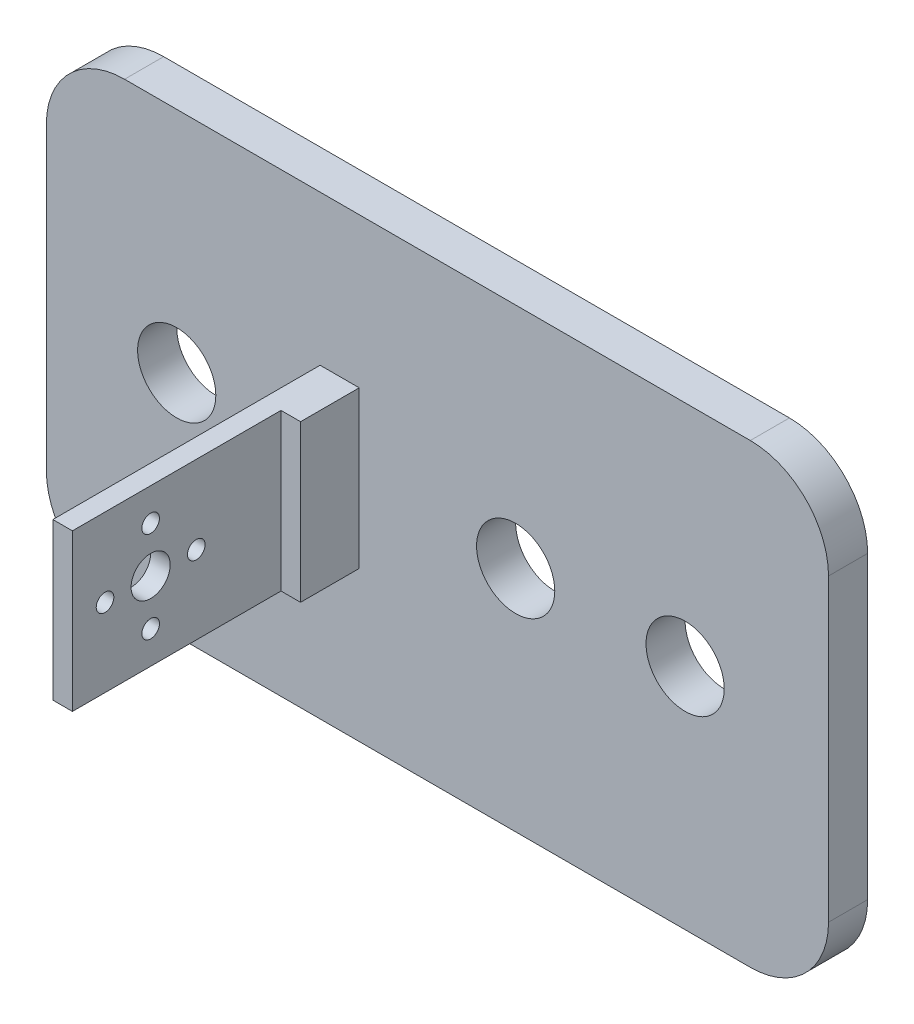
from build123d import *

# Parameters (mm, degrees)
S_BOX1_W      = 120
S_BOX1_H      = 70
BOSS_1_DEPTH  = 6
S_BOX2_W      = 3
S_BOX2_H      = 24
BOSS_2_DEPTH  = 41.5
S_BOX3_W      = 3.5
S_BOX3_H      = 24
BOSS_3_DEPTH  = 9.5
S_HOLE4_R     = 3
HOLE_4_DEPTH  = 3.2
S_HOLE5_R     = 1.35
HOLE_5_DEPTH  = 3.2
S_HOLE6_R     = 1.35
HOLE_6_DEPTH  = 3.2
S_HOLE7_R     = 1.35
HOLE_7_DEPTH  = 3.2
S_HOLE8_R     = 1.35
HOLE_8_DEPTH  = 3.2
S_HOLE9_R     = 6
HOLE_9_DEPTH  = 6.2
S_HOLE10_R    = 6
HOLE_10_DEPTH = 6.2
S_HOLE11_R    = 6
HOLE_11_DEPTH = 6.2
CUT_12_DEPTH  = 6.2
CUT_13_DEPTH  = 6.2
CUT_14_DEPTH  = 6.2
CUT_15_DEPTH  = 6.2


with BuildPart() as part:
    # S_box1 → Boss_1 (new body)
    with BuildSketch(Plane.XY.offset(-35)):
        with Locations((-2, 0)):
            Rectangle(S_BOX1_W, S_BOX1_H)
    extrude(amount=BOSS_1_DEPTH)

    # S_box2 → Boss_2 (add)
    with BuildSketch(Plane.XY.offset(-29.5)):
        with Locations((-18.5, 0)):
            Rectangle(S_BOX2_W, S_BOX2_H)
    extrude(amount=BOSS_2_DEPTH)

    # S_box3 → Boss_3 (add)
    with BuildSketch(Plane.XY.offset(-29.5)):
        with Locations((-15.75, 0)):
            Rectangle(S_BOX3_W, S_BOX3_H)
    extrude(amount=BOSS_3_DEPTH)

    # S_hole4 → Hole_4 (cut)
    with BuildSketch(Plane(origin=(-20.1, 0, 0), x_dir=(0, 0, -1), z_dir=(1, 0, 0))):
        Circle(S_HOLE4_R)
    extrude(amount=HOLE_4_DEPTH, mode=Mode.SUBTRACT)

    # S_hole5 → Hole_5 (cut)
    with BuildSketch(Plane(origin=(-20.1, 0, 0), x_dir=(0, 0, -1), z_dir=(1, 0, 0))):
        with Locations((0, 7)):
            Circle(S_HOLE5_R)
    extrude(amount=HOLE_5_DEPTH, mode=Mode.SUBTRACT)

    # S_hole6 → Hole_6 (cut)
    with BuildSketch(Plane(origin=(-20.1, 0, 0), x_dir=(0, 0, -1), z_dir=(1, 0, 0))):
        with Locations((-7, 0)):
            Circle(S_HOLE6_R)
    extrude(amount=HOLE_6_DEPTH, mode=Mode.SUBTRACT)

    # S_hole7 → Hole_7 (cut)
    with BuildSketch(Plane(origin=(-20.1, 0, 0), x_dir=(0, 0, -1), z_dir=(1, 0, 0))):
        with Locations((0, -7)):
            Circle(S_HOLE7_R)
    extrude(amount=HOLE_7_DEPTH, mode=Mode.SUBTRACT)

    # S_hole8 → Hole_8 (cut)
    with BuildSketch(Plane(origin=(-20.1, 0, 0), x_dir=(0, 0, -1), z_dir=(1, 0, 0))):
        with Locations((7, 0)):
            Circle(S_HOLE8_R)
    extrude(amount=HOLE_8_DEPTH, mode=Mode.SUBTRACT)

    # S_hole9 → Hole_9 (cut)
    with BuildSketch(Plane.XY.offset(-35.1)):
        with Locations((-42, 0)):
            Circle(S_HOLE9_R)
    extrude(amount=HOLE_9_DEPTH, mode=Mode.SUBTRACT)

    # S_hole10 → Hole_10 (cut)
    with BuildSketch(Plane.XY.offset(-35.1)):
        with Locations((10, 0)):
            Circle(S_HOLE10_R)
    extrude(amount=HOLE_10_DEPTH, mode=Mode.SUBTRACT)

    # S_hole11 → Hole_11 (cut)
    with BuildSketch(Plane.XY.offset(-35.1)):
        with Locations((36, 0)):
            Circle(S_HOLE11_R)
    extrude(amount=HOLE_11_DEPTH, mode=Mode.SUBTRACT)

    # S_pcut12 → Cut_12 (cut)
    with BuildSketch(Plane.XY.offset(-35.1)):
        with BuildLine():
            Line((58.6, 35.6), (46, 35.6))
            Line((46, 35.6), (46, 35))
            ThreePointArc((46, 35), (54.4853, 31.4853), (58, 23))
            Line((58, 23), (58.6, 23))
            Line((58.6, 23), (58.6, 35.6))
        make_face()
    extrude(amount=CUT_12_DEPTH, mode=Mode.SUBTRACT)

    # S_pcut13 → Cut_13 (cut)
    with BuildSketch(Plane.XY.offset(-35.1)):
        with BuildLine():
            Line((58.6, -35.6), (46, -35.6))
            Line((46, -35.6), (46, -35))
            ThreePointArc((46, -35), (54.4853, -31.4853), (58, -23))
            Line((58, -23), (58.6, -23))
            Line((58.6, -23), (58.6, -35.6))
        make_face()
    extrude(amount=CUT_13_DEPTH, mode=Mode.SUBTRACT)

    # S_pcut14 → Cut_14 (cut)
    with BuildSketch(Plane.XY.offset(-35.1)):
        with BuildLine():
            Line((-62.6, 35.6), (-50, 35.6))
            Line((-50, 35.6), (-50, 35))
            ThreePointArc((-50, 35), (-58.4853, 31.4853), (-62, 23))
            Line((-62, 23), (-62.6, 23))
            Line((-62.6, 23), (-62.6, 35.6))
        make_face()
    extrude(amount=CUT_14_DEPTH, mode=Mode.SUBTRACT)

    # S_pcut15 → Cut_15 (cut)
    with BuildSketch(Plane.XY.offset(-35.1)):
        with BuildLine():
            Line((-62.6, -35.6), (-50, -35.6))
            Line((-50, -35.6), (-50, -35))
            ThreePointArc((-50, -35), (-58.4853, -31.4853), (-62, -23))
            Line((-62, -23), (-62.6, -23))
            Line((-62.6, -23), (-62.6, -35.6))
        make_face()
    extrude(amount=CUT_15_DEPTH, mode=Mode.SUBTRACT)


solid = part.part
